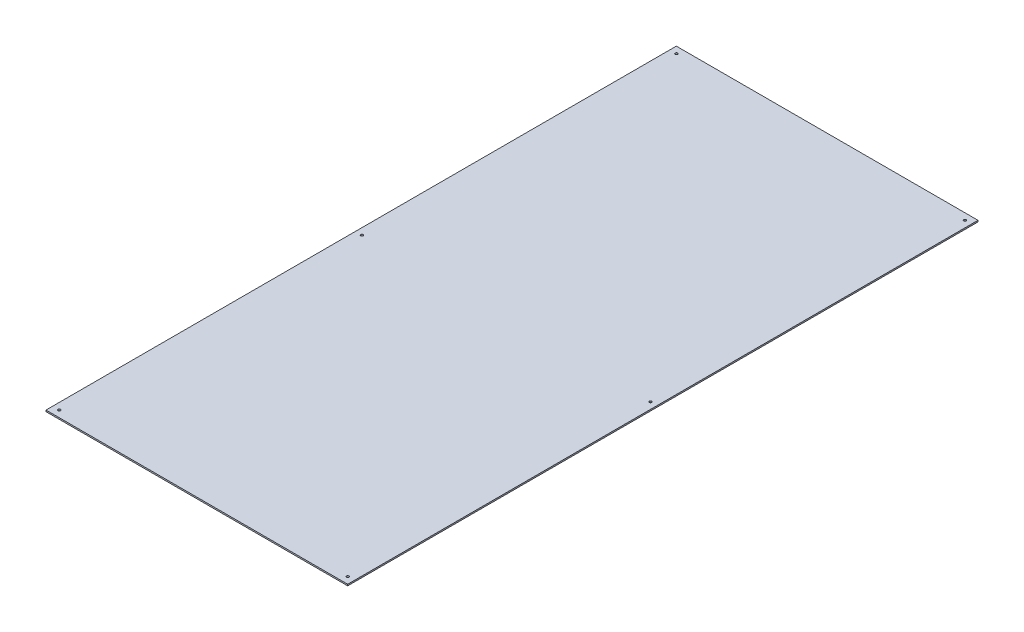
from build123d import *

# Parameters (mm, degrees)
SKETCH1_W           = 582
SKETCH1_H           = 1216.025
SKETCH1_R           = 2.38125
BOSS_EXTRUDE1_DEPTH = 2.8


with BuildPart() as part:
    # Sketch1 → Boss-Extrude1 (new body)
    with BuildSketch(Plane(origin=(0, 0, 0), x_dir=(1, 0, 0), z_dir=(0, 1, 0))):
        Rectangle(SKETCH1_W, SKETCH1_H)
        with Locations((278.3, 595.3125)):
            Circle(SKETCH1_R, mode=Mode.SUBTRACT)
        with Locations((-278.3, 595.3125)):
            Circle(SKETCH1_R, mode=Mode.SUBTRACT)
        with Locations((-278.3, -11.1125)):
            Circle(SKETCH1_R, mode=Mode.SUBTRACT)
        with Locations((278.3, -11.1125)):
            Circle(SKETCH1_R, mode=Mode.SUBTRACT)
        with Locations((-278.3, -595.3125)):
            Circle(SKETCH1_R, mode=Mode.SUBTRACT)
        with Locations((278.3, -595.3125)):
            Circle(SKETCH1_R, mode=Mode.SUBTRACT)
    extrude(amount=BOSS_EXTRUDE1_DEPTH)


solid = part.part
